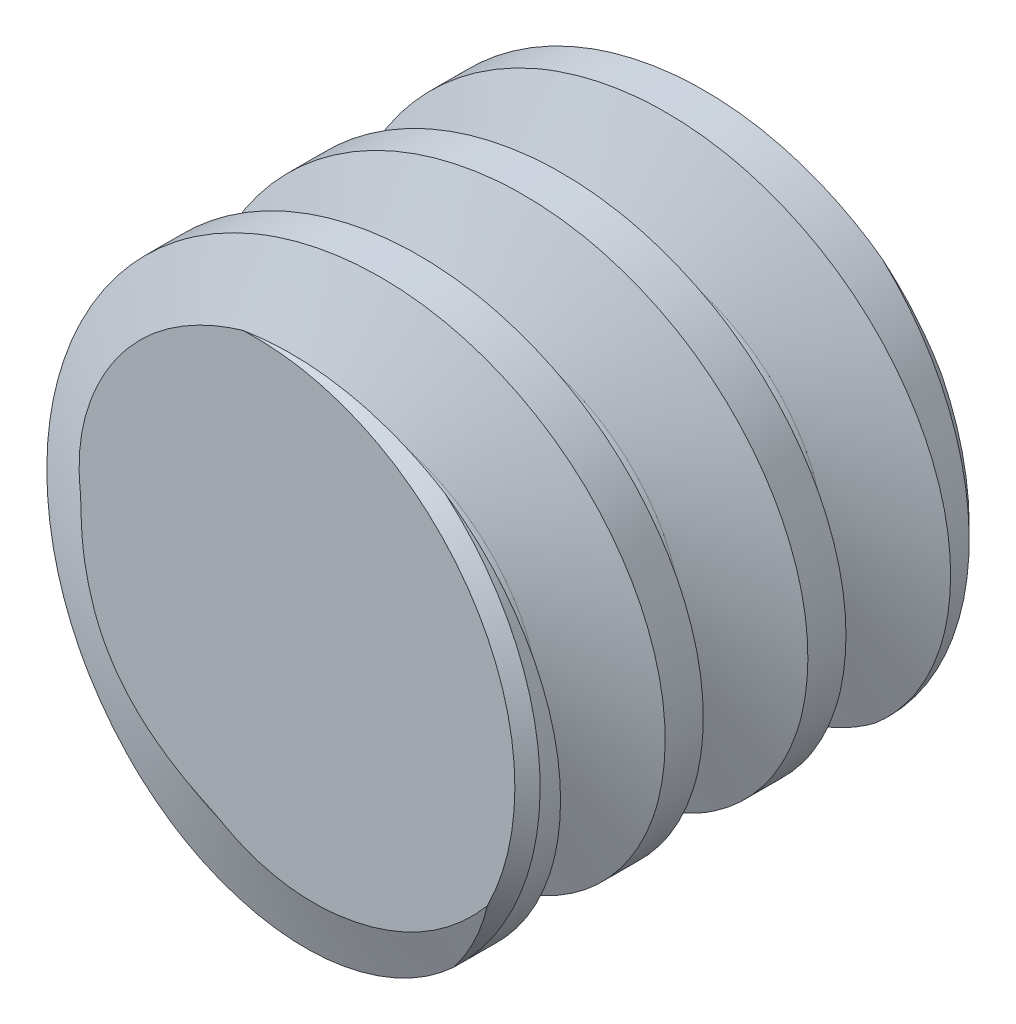
from build123d import *

# Parameters (mm, degrees)
TOOTHCUTWORM01_PITCH = 3.141592606


with BuildPart() as part:
    # SketchRevolveWorm01 → Worm01 (revolve)
    with BuildSketch(Plane(origin=(0, 0, 0), x_dir=(0, 0, -1), z_dir=(1, 0, 0)), mode=Mode.PRIVATE) as worm01_sk:
        Polygon((5, 0), (5, 5.721999985), (4.722, 5.999999985), (-4.722, 5.999999985), (-5, 5.721999985), (-5, 0), align=None)
    revolve(worm01_sk.sketch.rotate(Axis((0, 0, 0), (0, 0, -1)), 90), axis=Axis((0, 0, 0), (0, 0, -1)))

    # ToothCutWorm01: the profile of SketchToothWorm01 screwed along a right-hand helix of 6 turns, 10 arcs to a turn; built about Z, then put on its axis
    toothcutworm01_z = Axis((0, 0, 0), (0, 0, 1))
    toothcutworm01_corners = [(6.249999981, 0, 1.242827032), (3.946903331, 0, 0.400024681), (3.750000019, 0, 0.118295962), (3.750000019, 0, -0.118295962), (3.946903331, 0, -0.400024681), (6.249999981, 0, -1.242827032)]
    with BuildLine(mode=Mode.PRIVATE) as toothcutworm01_profile:
        Line(toothcutworm01_corners[0], toothcutworm01_corners[1])
        Line(toothcutworm01_corners[2], toothcutworm01_corners[3])
        Line(toothcutworm01_corners[4], toothcutworm01_corners[5])
        Line(toothcutworm01_corners[5], toothcutworm01_corners[0])
        ThreePointArc((3.946903331, 0, 0.400024681), (3.804104709, 0, 0.290154905), (3.750000019, 0, 0.118295962))
        ThreePointArc((3.750000019, 0, -0.118295962), (3.804104709, 0, -0.290154905), (3.946903331, 0, -0.400024681))
    toothcutworm01_cap = Face(toothcutworm01_profile.wire())
    toothcutworm01_arcs = [((3.946903331, 0, 0.400024681), (3.750000019, 0, 0.327969271), (3.750000019, 0, 0.118295962), (1, 0.8196510285854599, 1)), ((3.750000019, 0, -0.118295962), (3.750000019, 0, -0.327969271), (3.946903331, 0, -0.400024681), (1, 0.8196510285854628, 1))]  # start, shoulder, end, weights
    toothcutworm01_turn_angles = [0, 18, 36, 54, 72, 90, 108, 126, 144, 162, 180, 198, 216, 234, 252, 270, 288, 306, 324, 342, 360]
    toothcutworm01_turn_weights = [1, 0.9510565162951535, 1, 0.9510565162951535, 1, 0.9510565162951535, 1, 0.9510565162951535, 1, 0.9510565162951535, 1, 0.9510565162951535, 1, 0.9510565162951535, 1, 0.9510565162951535, 1, 0.9510565162951535, 1, 0.9510565162951535, 1]
    toothcutworm01_turn_rails = [Edge.make_bspline([Vector(p[0], p[1], 0).rotate(toothcutworm01_z, toothcutworm01_turn_angles[k]) / toothcutworm01_turn_weights[k] + Vector(0, 0, p[2] + TOOTHCUTWORM01_PITCH * toothcutworm01_turn_angles[k] / 360) for k in range(21)], [0, 0, 0, 1, 1, 2, 2, 3, 3, 4, 4, 5, 5, 6, 6, 7, 7, 8, 8, 9, 9, 10, 10, 10], 2, toothcutworm01_turn_weights) for p in toothcutworm01_corners]
    toothcutworm01_turn_sides = [*[Face.make_surface_from_curves(toothcutworm01_turn_rails[p[0]], toothcutworm01_turn_rails[p[1]]) for p in [(0, 1), (2, 3), (4, 5), (5, 0)]], *[Face.make_bezier_surface([[Vector(p[j][0], p[j][1], 0).rotate(toothcutworm01_z, toothcutworm01_turn_angles[2 * i + k]) / toothcutworm01_turn_weights[2 * i + k] + Vector(0, 0, p[j][2] + TOOTHCUTWORM01_PITCH * toothcutworm01_turn_angles[2 * i + k] / 360) for k in range(3)] for j in range(3)], [[p[3][j] * toothcutworm01_turn_weights[2 * i + k] for k in range(3)] for j in range(3)]) for p in toothcutworm01_arcs for i in range(10)]]
    toothcutworm01 = Plane(origin=(0, 0, 9.424777819), x_dir=(1, 0, 0), z_dir=(0, 0, -1)) * Solid(Shell([*[p.moved(Location((0, 0, TOOTHCUTWORM01_PITCH * i))) for i in range(6) for p in toothcutworm01_turn_sides], toothcutworm01_cap, toothcutworm01_cap.rotate(toothcutworm01_z, 2160).moved(Location((0, 0, TOOTHCUTWORM01_PITCH * 2160 / 360)))]))
    add(toothcutworm01, mode=Mode.SUBTRACT)


solid = part.part
